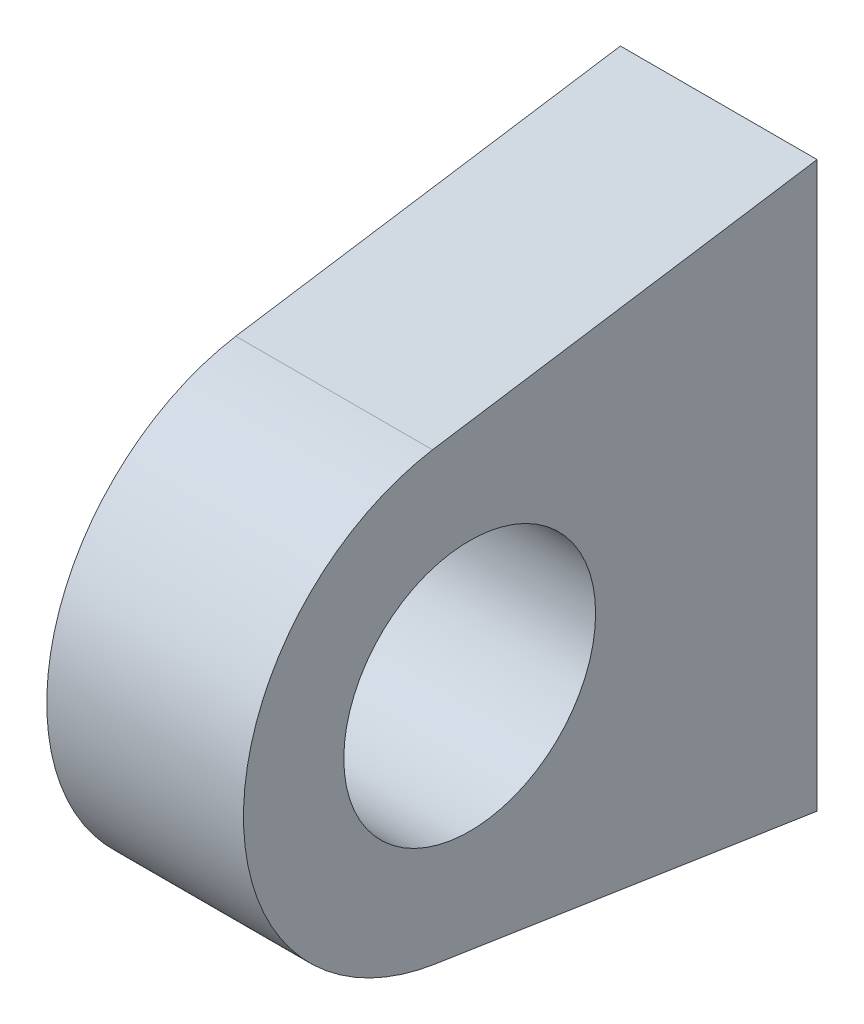
from build123d import *

# Parameters (mm, degrees)
SZKIC19_R                   = 3.2
DODANIE_WYCI_GNI_CIE4_DEPTH = 5


with BuildPart() as part:
    # Szkic19 → Dodanie-wyciągnięcie4 (new body)
    with BuildSketch(Plane(origin=(91.785447504, 0, 0), x_dir=(0, 0, -1), z_dir=(1, 0, 0))):
        with BuildLine():
            ThreePointArc((-28.445954588, 5.671654954), (-33.249877683, -0.037505144), (-28.371887415, -5.683512324))
            Line((-28.371887415, -5.683512324), (-18.669879005, -7.171862934))
            Line((-18.669879005, -7.171862934), (-18.669879005, 7.171862934))
            Line((-18.669879005, 7.171862934), (-28.445954588, 5.671654954))
        make_face()
        with Locations((-27.5, 0)):
            Circle(SZKIC19_R, mode=Mode.SUBTRACT)
    extrude(amount=-DODANIE_WYCI_GNI_CIE4_DEPTH)


solid = part.part
